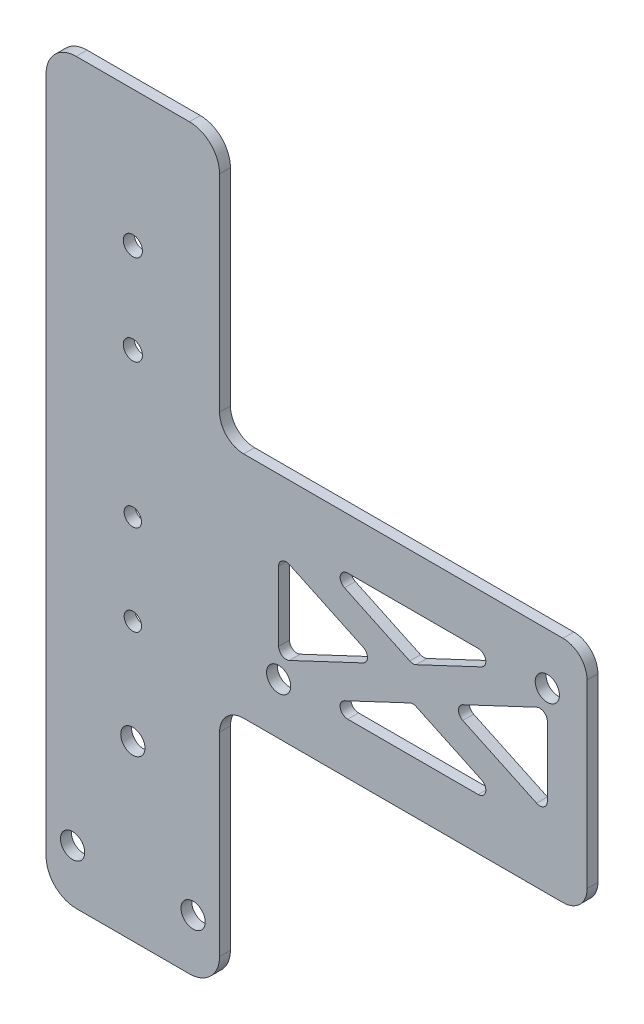
from build123d import *

# Parameters (mm, degrees)
SKETCH1_R           = 2.5527
SKETCH1_R_2         = 1.8288
SKETCH1_R_3         = 2.0193
BOSS_EXTRUDE1_DEPTH = 2.286
CUT_EXTRUDE1_DEPTH  = 128.490937977
FILLET1_R           = 1.5875


with BuildPart() as part:
    # Sketch1 → Boss-Extrude1 (new body)
    with BuildSketch(Plane.XY.offset(1.5875)):
        with BuildLine():
            Line((18.288, -65.0875), (18.288, -24.13))
            ThreePointArc((18.288, -24.13), (19.775897552, -20.537897552), (23.368, -19.05))
            Line((23.368, -19.05), (90.678, -19.05))
            ThreePointArc((90.678, -19.05), (94.270102448, -17.562102448), (95.758, -13.97))
            Line((95.758, -13.97), (95.758, 24.13))
            ThreePointArc((95.758, 24.13), (94.270102448, 27.722102448), (90.678, 29.21))
            Line((90.678, 29.21), (23.368, 29.21))
            ThreePointArc((23.368, 29.21), (19.775897552, 30.697897552), (18.288, 34.29))
            Line((18.288, 34.29), (18.288, 77.7875))
            ThreePointArc((18.288, 77.7875), (16.428128061, 82.277628061), (11.938, 84.1375))
            Line((11.938, 84.1375), (-11.938, 84.1375))
            ThreePointArc((-11.938, 84.1375), (-16.428128061, 82.277628061), (-18.288, 77.7875))
            Line((-18.288, 77.7875), (-18.288, -65.0875))
            ThreePointArc((-18.288, -65.0875), (-16.428128061, -69.577628061), (-11.938, -71.4375))
            Line((-11.938, -71.4375), (11.938, -71.4375))
            ThreePointArc((11.938, -71.4375), (16.428128061, -69.577628061), (18.288, -65.0875))
        make_face()
        with Locations((87.376, 18.415)):
            Circle(SKETCH1_R, mode=Mode.SUBTRACT)
        with Locations((30.734, -8.255)):
            Circle(SKETCH1_R, mode=Mode.SUBTRACT)
        with Locations((0, -13.0175)):
            Circle(SKETCH1_R_2, mode=Mode.SUBTRACT)
        with Locations((0, 6.0325)):
            Circle(SKETCH1_R_2, mode=Mode.SUBTRACT)
        with Locations((0, 36.5125)):
            Circle(SKETCH1_R_3, mode=Mode.SUBTRACT)
        with Locations((0, 55.5625)):
            Circle(SKETCH1_R_3, mode=Mode.SUBTRACT)
        with Locations((12.7, -60.325)):
            Circle(SKETCH1_R, mode=Mode.SUBTRACT)
        with Locations((-12.7, -60.325)):
            Circle(SKETCH1_R, mode=Mode.SUBTRACT)
        with Locations((0, -34.925)):
            Circle(SKETCH1_R, mode=Mode.SUBTRACT)
    extrude(amount=-BOSS_EXTRUDE1_DEPTH)

    # Sketch2 → Cut-Extrude1 (cut, through all)
    with BuildSketch(Plane.XY.offset(1.5875)):
        Polygon((79.922815554, 18.415), (38.187184446, 18.415), (59.055, 8.589346937), align=None)
        Polygon((51.601815554, 5.08), (30.734, 14.905653063), (30.734, -4.745653063), align=None)
        Polygon((87.376, 14.905653063), (66.508184446, 5.08), (87.376, -4.745653063), align=None)
        Polygon((79.922815554, -8.255), (59.055, 1.570653063), (38.187184446, -8.255), align=None)
    extrude(amount=-CUT_EXTRUDE1_DEPTH, mode=Mode.SUBTRACT)

    # Fillet1
    fillet1_edges = [part.edges().sort_by_distance(p)[0] for p in [
        (87.376, 14.905653063, 0.4445),
        (87.376, -4.745653063, 0.4445),
        (66.508184446, 5.08, 0.4445),
        (79.922815554, 18.415, 0.4445),
        (59.055, 8.589346937, 0.4445),
        (38.187184446, 18.415, 0.4445),
        (51.601815554, 5.08, 0.4445),
        (30.734, 14.905653063, 0.4445),
        (79.922815554, -8.255, 0.4445),
        (38.187184446, -8.255, 0.4445),
        (59.055, 1.570653063, 0.4445),
        (30.734, -4.745653063, 0.4445),
    ]]
    fillet(fillet1_edges, radius=FILLET1_R)


solid = part.part
